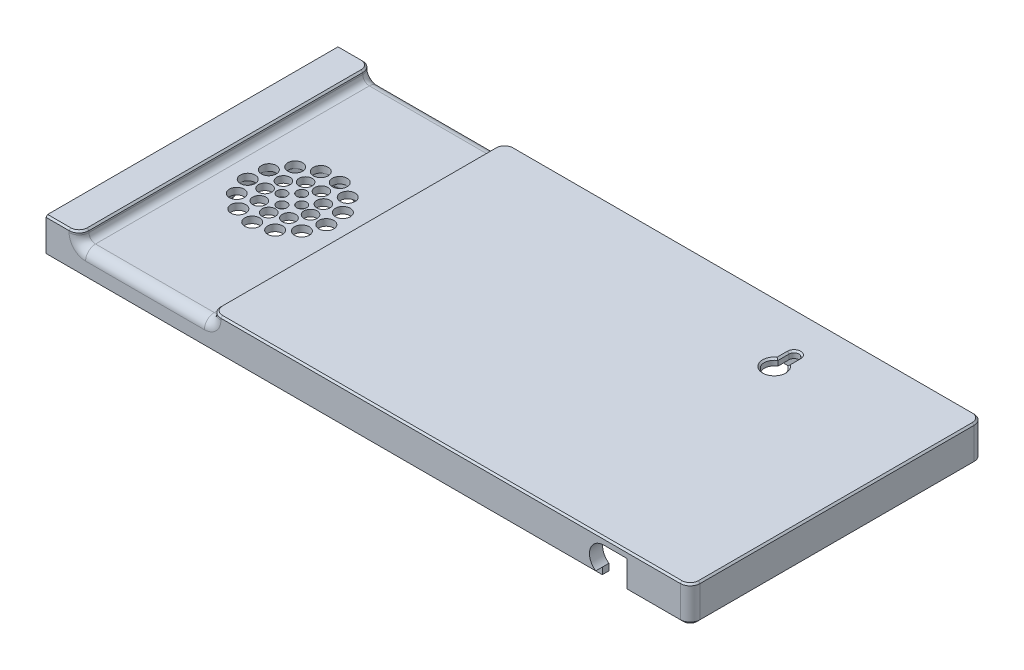
from build123d import *

# Parameters (mm, degrees)
SKETCH1_W           = 326.5
SKETCH1_H           = 85
SKETCH1_W_2         = 322.5
SKETCH1_H_2         = 81
BOSS_EXTRUDE1_DEPTH = 10
SKETCH2_W           = 330.5
SKETCH2_H           = 89
SKETCH2_W_2         = 322.5
SKETCH2_H_2         = 81
BOSS_EXTRUDE2_DEPTH = 8
SKETCH3_W           = 330.5
SKETCH3_H           = 89
BOSS_EXTRUDE3_DEPTH = 2
FILLET1_R           = 3
FILLET2_R           = 2
FILLET3_R           = 3
CHAMFER1_SIZE       = 0.5
CUT_EXTRUDE1_DEPTH  = 172.557024047
CHAMFER2_SIZE       = 0.5
SKETCH7_W           = 40
SKETCH7_H           = 6.166023439
CUT_EXTRUDE3_DEPTH  = 189.075948755
BOSS_EXTRUDE4_REACH = 190.076
FILLET4_R           = 2
CHAMFER3_SIZE       = 0.5
FILLET5_R           = 3
FILLET6_R           = 2
SKETCH9_R           = 16.25
SKETCH9_R_2         = 14.25
BOSS_EXTRUDE5_DEPTH = 3
SKETCH10_R          = 1.5
SKETCH10_R_2        = 2
SKETCH10_R_3        = 2.25
CUT_EXTRUDE4_DEPTH  = 172.279924393
CHAMFER4_SIZE       = 0.5
SKETCH12_W          = 30.6
SKETCH12_H          = 39
SKETCH12_W_2        = 26.6
SKETCH12_H_2        = 35
BOSS_EXTRUDE6_DEPTH = 6
SKETCH13_W          = 30.6
SKETCH13_H          = 4
BOSS_EXTRUDE7_DEPTH = 2.7
SKETCH14_W          = 3.373769955
SKETCH14_H          = 15.899358316
SKETCH14_W_2        = 15.312861043
SKETCH14_H_2        = 6.106571476
SKETCH14_W_3        = 6.70369678
SKETCH14_H_3        = 18.082973575
CUT_EXTRUDE5_DEPTH  = 6
FILLET7_R           = 2
CUT_EXTRUDE6_DEPTH  = 12.7
CUT_EXTRUDE7_DEPTH  = 12.7
CUT_EXTRUDE8_DEPTH  = 12.7
SKETCH19_W          = 25
SKETCH19_H          = 25.3
SKETCH19_W_2        = 21
SKETCH19_H_2        = 21.3
BOSS_EXTRUDE8_DEPTH = 6
SKETCH20_W          = 17
SKETCH20_H          = 11.292116592
CUT_EXTRUDE9_DEPTH  = 6
FILLET8_R           = 2
FILLET9_R           = 2
FILLET10_R          = 1
SKETCH18_W          = 146.063438611
SKETCH18_H          = 131.716143141
CUT_EXTRUDE10_DEPTH = 172.557024047


with BuildPart() as part:
    # Sketch1 → Boss-Extrude1 (new body)
    with BuildSketch(Plane(origin=(0, 0, 0), x_dir=(1, 0, 0), z_dir=(0, 1, 0))):
        Rectangle(SKETCH1_W, SKETCH1_H)
        Rectangle(SKETCH1_W_2, SKETCH1_H_2, mode=Mode.SUBTRACT)
    extrude(amount=BOSS_EXTRUDE1_DEPTH)

    # Sketch2 → Boss-Extrude2 (add)
    with BuildSketch(Plane(origin=(0, 10, 0), x_dir=(1, 0, 0), z_dir=(0, 1, 0))):
        Rectangle(SKETCH2_W, SKETCH2_H)
        Rectangle(SKETCH2_W_2, SKETCH2_H_2, mode=Mode.SUBTRACT)
    extrude(amount=-BOSS_EXTRUDE2_DEPTH)

    # Sketch3 → Boss-Extrude3 (add)
    with BuildSketch(Plane(origin=(0, 10, 0), x_dir=(1, 0, 0), z_dir=(0, 1, 0))):
        Rectangle(SKETCH3_W, SKETCH3_H)
    extrude(amount=BOSS_EXTRUDE3_DEPTH)

    # Fillet1
    fillet1_edges = [part.edges().sort_by_distance(p)[0] for p in [
        (161.25, 5, 40.5),
        (161.25, 5, -40.5),
        (-161.25, 5, -40.5),
        (-161.25, 5, 40.5),
    ]]
    fillet(fillet1_edges, radius=FILLET1_R)

    # Fillet2
    fillet2_edges = [part.edges().sort_by_distance(p)[0] for p in [
        (163.25, 1, 42.5),
        (-163.25, 1, 42.5),
        (-163.25, 1, -42.5),
        (163.25, 1, -42.5),
    ]]
    fillet(fillet2_edges, radius=FILLET2_R)

    # Fillet3
    fillet3_edges = [part.edges().sort_by_distance(p)[0] for p in [
        (165.25, 7, -44.5),
        (165.25, 7, 44.5),
        (-165.25, 7, 44.5),
        (-165.25, 7, -44.5),
    ]]
    fillet(fillet3_edges, radius=FILLET3_R)

    # Chamfer1
    chamfer1_edges = [part.edges().sort_by_distance(p)[0] for p in [
        (165.25, 12, 0),
        (-165.25, 12, 0),
        (0, 12, 44.5),
        (0, 12, -44.5),
        (-164.371320344, 12, -43.621320344),
        (-164.371320344, 12, 43.621320344),
        (164.371320344, 12, 43.621320344),
        (164.371320344, 12, -43.621320344),
    ]]
    chamfer(chamfer1_edges, length=CHAMFER1_SIZE)

    # Sketch4 → Cut-Extrude1 (cut, through all)
    with BuildSketch(Plane(origin=(0, 12, 0), x_dir=(1, 0, 0), z_dir=(0, 1, 0))):
        with BuildLine():
            Line((-121.5, 32.222687085), (-121.5, 28.820763297))
            ThreePointArc((-121.5, 28.820763297), (-120, 23.222687085), (-118.5, 28.820763297))
            Line((-118.5, 28.820763297), (-118.5, 32.222687085))
            ThreePointArc((-118.5, 32.222687085), (-120, 33.722687085), (-121.5, 32.222687085))
        make_face()
        with BuildLine():
            Line((118.5, 32.222687085), (118.5, 28.820763297))
            ThreePointArc((118.5, 28.820763297), (120, 23.222687085), (121.5, 28.820763297))
            Line((121.5, 28.820763297), (121.5, 32.222687085))
            ThreePointArc((121.5, 32.222687085), (120, 33.722687085), (118.5, 32.222687085))
        make_face()
    extrude(amount=-CUT_EXTRUDE1_DEPTH, mode=Mode.SUBTRACT)

    # Chamfer2
    chamfer2_edges = [part.edges().sort_by_distance(p)[0] for p in [
        (-120, 12, -33.722687085),
        (-121.5, 12, -30.521725191),
        (-120, 12, -23.222687085),
        (-118.5, 12, -30.521725191),
        (120, 12, -33.722687085),
        (118.5, 12, -30.521725191),
        (120, 12, -23.222687085),
        (121.5, 12, -30.521725191),
    ]]
    chamfer(chamfer2_edges, length=CHAMFER2_SIZE)

    # Sketch7 → Cut-Extrude3 (cut, through all)
    with BuildSketch(Plane(origin=(0, 0, -44.5), x_dir=(-1, 0, 0), z_dir=(0, 0, -1))):
        with Locations((0, 12.083011719)):
            Rectangle(SKETCH7_W, SKETCH7_H)
    extrude(amount=-CUT_EXTRUDE3_DEPTH, mode=Mode.SUBTRACT)

    # Boss-Extrude4: up to this face of the body (flat: up to its plane)
    boss_extrude4_end = Plane(part.part.faces().sort_by_distance((0, 6.63265862, 44.5))[0])
    # Sketch8 → Boss-Extrude4 (add, up to the picked face)
    with BuildSketch(Plane(origin=(0, 0, -44.5), x_dir=(-1, 0, 0), z_dir=(0, 0, -1)), mode=Mode.PRIVATE) as boss_extrude4_sk1:
        Polygon((-20, 12), (-20, 9), (20, 9), (20, 12), (22, 12), (22, 7), (-22, 7), (-22, 12), align=None)
    boss_extrude4_tool1 = split(extrude(boss_extrude4_sk1.sketch, amount=-BOSS_EXTRUDE4_REACH, mode=Mode.PRIVATE), bisect_by=boss_extrude4_end, keep=Keep.BOTH, mode=Mode.PRIVATE)
    add(boss_extrude4_tool1.solids().sort_by(Axis((0, 8.3, -44.5), (0, 0, 1)))[0])

    # Fillet4
    fillet4_edges = [part.edges().sort_by_distance(p)[0] for p in [
        (-20, 9, 0),
        (20, 9, 0),
    ]]
    fillet(fillet4_edges, radius=FILLET4_R)

    # Chamfer3
    chamfer3_edges = [part.edges().sort_by_distance(p)[0] for p in [
        (-21, 12, 44.5),
        (21, 12, 44.5),
        (-21, 12, -44.5),
        (21, 12, -44.5),
    ]]
    chamfer(chamfer3_edges, length=CHAMFER3_SIZE - 0.0001)  # a hair under: the kernel refuses the full size

    # Fillet5
    fillet5_edges = [part.edges().sort_by_distance(p)[0] for p in [
        (20, 11.25005, 44.5),
        (19.414213562, 9.585786438, 44.5),
        (-20, 11.25005, 44.5),
        (-19.414213562, 9.585786438, 44.5),
        (20, 11.25005, -44.5),
        (19.414213562, 9.585786438, -44.5),
        (-20, 11.25005, -44.5),
        (-19.414213562, 9.585786438, -44.5),
        (0, 9, -44.5),
        (0, 9, 44.5),
    ]]
    fillet(fillet5_edges, radius=FILLET5_R)

    # Fillet6
    fillet6_edges = [part.edges().sort_by_distance(p)[0] for p in [
        (22, 10, 0),
        (-22, 10, 0),
    ]]
    fillet(fillet6_edges, radius=FILLET6_R)

    # Sketch9 → Boss-Extrude5 (add)
    with BuildSketch(Plane.XZ.offset(-7)):
        Circle(SKETCH9_R)
        Circle(SKETCH9_R_2, mode=Mode.SUBTRACT)
    extrude(amount=BOSS_EXTRUDE5_DEPTH)

    # Sketch10 → Cut-Extrude4 (cut, through all)
    with BuildSketch(Plane.XZ.offset(-7)):
        with Locations((0, 3)):
            Circle(SKETCH10_R)
        with Locations((0, 7)):
            Circle(SKETCH10_R_2)
        with Locations((0, 12)):
            Circle(SKETCH10_R_3)
        with Locations((4.499513268, 5.362311102)):
            Circle(SKETCH10_R_2)
        with Locations((6.893654271, 1.215537244)):
            Circle(SKETCH10_R_2)
        with Locations((6.062177826, -3.5)):
            Circle(SKETCH10_R_2)
        with Locations((2.394141003, -6.577848346)):
            Circle(SKETCH10_R_2)
        with Locations((-2.394141003, -6.577848346)):
            Circle(SKETCH10_R_2)
        with Locations((-6.062177826, -3.5)):
            Circle(SKETCH10_R_2)
        with Locations((-6.893654271, 1.215537244)):
            Circle(SKETCH10_R_2)
        with Locations((-4.499513268, 5.362311102)):
            Circle(SKETCH10_R_2)
        with Locations((3, 0)):
            Circle(SKETCH10_R)
        with Locations((0, -3)):
            Circle(SKETCH10_R)
        with Locations((-3, 0)):
            Circle(SKETCH10_R)
        with Locations((5.576678065, 10.625472308)):
            Circle(SKETCH10_R_3)
        with Locations((9.875806391, 6.816776961)):
            Circle(SKETCH10_R_3)
        with Locations((11.912506489, 1.446440163)):
            Circle(SKETCH10_R_3)
        with Locations((11.220194912, -4.255258645)):
            Circle(SKETCH10_R_3)
        with Locations((7.957471899, -8.982128978)):
            Circle(SKETCH10_R_3)
        with Locations((2.871787971, -11.651301809)):
            Circle(SKETCH10_R_3)
        with Locations((-2.871787971, -11.651301809)):
            Circle(SKETCH10_R_3)
        with Locations((-7.957471899, -8.982128978)):
            Circle(SKETCH10_R_3)
        with Locations((-11.220194912, -4.255258645)):
            Circle(SKETCH10_R_3)
        with Locations((-11.912506489, 1.446440163)):
            Circle(SKETCH10_R_3)
        with Locations((-9.875806391, 6.816776961)):
            Circle(SKETCH10_R_3)
        with Locations((-5.576678065, 10.625472308)):
            Circle(SKETCH10_R_3)
    extrude(amount=-CUT_EXTRUDE4_DEPTH, mode=Mode.SUBTRACT)

    # Chamfer4
    chamfer4_edges = [part.edges().sort_by_distance(p)[0] for p in [
        (-20.35666074, 12, -42.918716869),
        (-20.35666074, 12, 42.918716869),
        (-20, 12, 0),
        (20.35666074, 12, 42.918716869),
        (20.35666074, 12, -42.918716869),
        (20, 12, 0),
    ]]
    chamfer(chamfer4_edges, length=CHAMFER4_SIZE - 0.0001)  # a hair under: the kernel refuses the full size

    # Sketch12 → Boss-Extrude6 (add)
    with BuildSketch(Plane.XZ.offset(-10)):
        with Locations((142.95, 3)):
            Rectangle(SKETCH12_W, SKETCH12_H)
        with Locations((142.95, 3)):
            Rectangle(SKETCH12_W_2, SKETCH12_H_2, mode=Mode.SUBTRACT)
    extrude(amount=BOSS_EXTRUDE6_DEPTH)

    # Sketch13 → Boss-Extrude7 (add)
    with BuildSketch(Plane.XZ.offset(-10)):
        with Locations((142.95, -14.5)):
            Rectangle(SKETCH13_W, SKETCH13_H)
    extrude(amount=BOSS_EXTRUDE7_DEPTH)

    # Sketch14 → Cut-Extrude5 (cut)
    with BuildSketch(Plane.XZ.offset(-4)):
        with Locations((157.936884978, 16.074384573)):
            Rectangle(SKETCH14_W, SKETCH14_H)
        with Locations((143.337214565, 21.464137582)):
            Rectangle(SKETCH14_W_2, SKETCH14_H_2)
        with Locations((129.195604024, 2.873540073)):
            Rectangle(SKETCH14_W_3, SKETCH14_H_3)
    extrude(amount=-CUT_EXTRUDE5_DEPTH, mode=Mode.SUBTRACT)

    # Fillet7
    fillet7_edges = [part.edges().sort_by_distance(p)[0] for p in [
        (150.993645086, 7, 20.5),
        (135.680784043, 7, 20.5),
        (129.65, 7, 11.91502686),
        (156.25, 7, 8.124705415),
        (129.65, 7, -6.167946715),
    ]]
    fillet(fillet7_edges, radius=FILLET7_R - 0.0001)  # a hair under: the kernel refuses the full size

    # Sketch15 → Cut-Extrude6 (cut)
    with BuildSketch(Plane.XY.offset(-40.5)):
        with BuildLine():
            Line((142.732418969, 8.83308219), (145.68707631, 8.83308219))
            ThreePointArc((145.68707631, 8.83308219), (146.85974764, 6.63308219), (145.68707631, 4.43308219))
            Line((145.68707631, 4.43308219), (142.732418969, 4.43308219))
            ThreePointArc((142.732418969, 4.43308219), (141.55974764, 6.63308219), (142.732418969, 8.83308219))
        make_face()
    extrude(amount=-CUT_EXTRUDE6_DEPTH, mode=Mode.SUBTRACT)

    # Sketch16 → Cut-Extrude7 (cut)
    with BuildSketch(Plane(origin=(0, 0, 40.5), x_dir=(-1, 0, 0), z_dir=(0, 0, -1))):
        with BuildLine():
            Line((-146.114315764, 9.98869973), (-139.089315764, 9.98869973))
            ThreePointArc((-139.089315764, 9.98869973), (-134.714315764, 5.61369973), (-139.089315764, 1.23869973))
            Line((-139.089315764, 1.23869973), (-146.114315764, 1.23869973))
            Line((-146.114315764, 1.23869973), (-146.114315764, 5.61369973))
            Line((-146.114315764, 5.61369973), (-146.114315764, 9.98869973))
        make_face()
    extrude(amount=-CUT_EXTRUDE7_DEPTH, mode=Mode.SUBTRACT)

    # Sketch17 → Cut-Extrude8 (cut)
    with BuildSketch(Plane.XY.offset(44.5)):
        Polygon((136.623185341, 2), (146.114315764, 4.571516723), (146.114315764, -5.033546584), (136.623185341, -4.403350122), align=None)
    extrude(amount=-CUT_EXTRUDE8_DEPTH, mode=Mode.SUBTRACT)

    # Sketch19 → Boss-Extrude8 (add)
    with BuildSketch(Plane.XZ.offset(-10)):
        with Locations((48.241330984, -14.734055582)):
            Rectangle(SKETCH19_W, SKETCH19_H)
        with Locations((48.241330984, -14.734055582)):
            Rectangle(SKETCH19_W_2, SKETCH19_H_2, mode=Mode.SUBTRACT)
    extrude(amount=BOSS_EXTRUDE8_DEPTH)

    # Sketch20 → Cut-Extrude9 (cut)
    with BuildSketch(Plane.XZ.offset(-4)):
        with Locations((48.241330984, -27.384055582)):
            Rectangle(SKETCH20_W, SKETCH20_H)
    extrude(amount=-CUT_EXTRUDE9_DEPTH, mode=Mode.SUBTRACT)

    # Fillet8
    fillet8_edges = [part.edges().sort_by_distance(p)[0] for p in [
        (39.741330984, 7, -25.384055582),
        (56.741330984, 7, -25.384055582),
    ]]
    fillet(fillet8_edges, radius=FILLET8_R - 0.0001)  # a hair under: the kernel refuses the full size

    # Fillet9
    fillet9_edges = [part.edges().sort_by_distance(p)[0] for p in [
        (60.741330984, 7, -2.084055582),
        (35.741330984, 7, -2.084055582),
        (158.25, 7, -16.5),
        (127.65, 7, 22.5),
        (127.65, 7, -16.5),
    ]]
    fillet(fillet9_edges, radius=FILLET9_R)

    # Fillet10
    fillet10_edges = [part.edges().sort_by_distance(p)[0] for p in [
        (-16.25, 4, 0),
        (-16.25, 7, 0),
        (-14.25, 4, 0),
    ]]
    fillet(fillet10_edges, radius=FILLET10_R - 0.0001)  # a hair under: the kernel refuses the full size

    # Sketch18 → Cut-Extrude10 (cut, through all)
    with BuildSketch(Plane(origin=(0, 12, 0), x_dir=(1, 0, 0), z_dir=(0, 1, 0))):
        with Locations((-103.037190747, -3.596714528)):
            Rectangle(SKETCH18_W, SKETCH18_H)
    extrude(amount=-CUT_EXTRUDE10_DEPTH, mode=Mode.SUBTRACT)


solid = part.part
